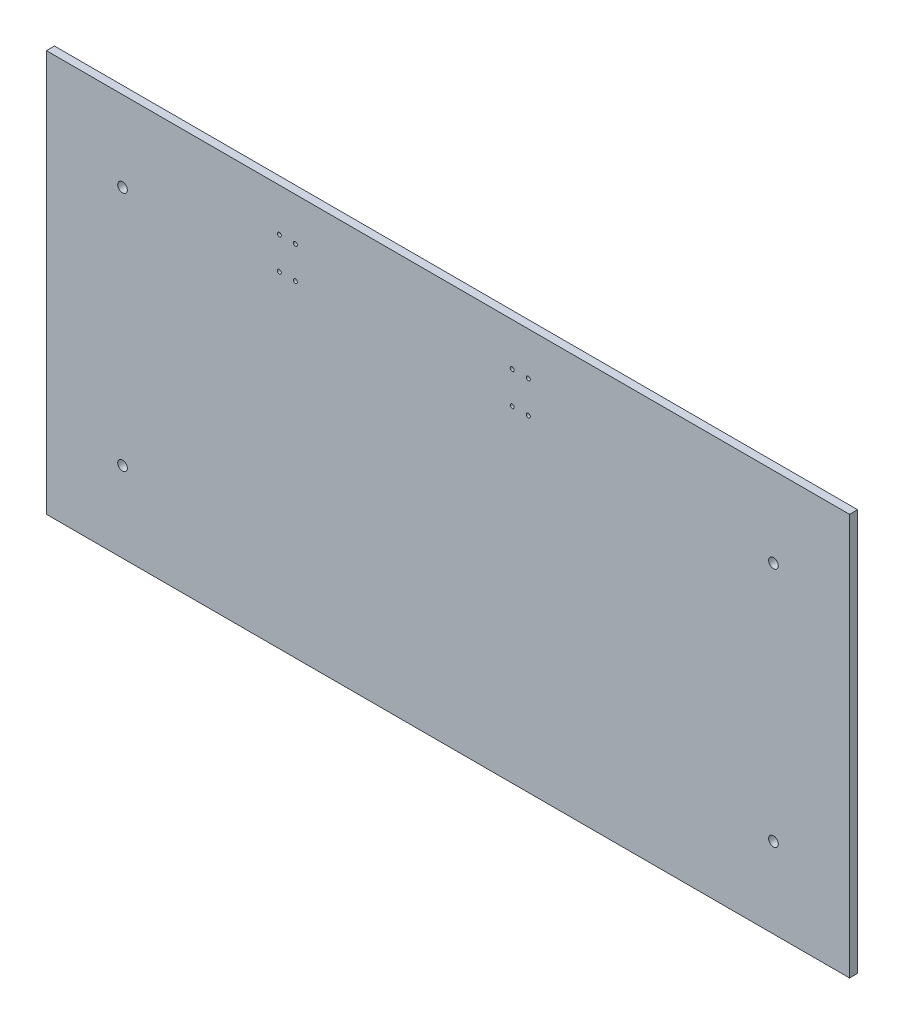
from build123d import *

# Parameters (mm, degrees)
SKETCH1_W           = 1000
SKETCH1_H           = 500
BOSS_EXTRUDE1_DEPTH = 10
SKETCH2_R           = 6
SKETCH2_R_2         = 2.5
CUT_EXTRUDE1_DEPTH  = 1393.332731882
SKETCH3_W           = 10
SKETCH3_H           = 200
BOSS_EXTRUDE2_DEPTH = 300
SKETCH4_R           = 5
CUT_EXTRUDE2_DEPTH  = 10
SKETCH7_W           = 307.440704133
SKETCH7_H           = 42.579188861
CUT_EXTRUDE5_DEPTH  = 1300


with BuildPart() as part:
    # Sketch1 → Boss-Extrude1 (new body)
    with BuildSketch(Plane.XY):
        with Locations((-555.321527736, 658.177796121)):
            Rectangle(SKETCH1_W, SKETCH1_H)
    extrude(amount=BOSS_EXTRUDE1_DEPTH)

    # Sketch2 → Cut-Extrude1 (cut, through all)
    with BuildSketch(Plane.XY.offset(10)):
        with Locations((-960.571527736, 808.177796121)):
            Circle(SKETCH2_R)
        with Locations((-960.571527736, 508.177796121)):
            Circle(SKETCH2_R)
        with Locations((-150.071527736, 508.177796121)):
            Circle(SKETCH2_R)
        with Locations((-150.071527736, 808.177796121)):
            Circle(SKETCH2_R)
        with Locations((-765.321527736, 854.697796121)):
            Circle(SKETCH2_R_2)
        with Locations((-745.321527736, 854.697796121)):
            Circle(SKETCH2_R_2)
        with Locations((-765.321527736, 814.697796121)):
            Circle(SKETCH2_R_2)
        with Locations((-745.321527736, 814.697796121)):
            Circle(SKETCH2_R_2)
        with Locations((-475.321527736, 814.697796121)):
            Circle(SKETCH2_R_2)
        with Locations((-455.321527736, 814.697796121)):
            Circle(SKETCH2_R_2)
        with Locations((-475.321527736, 854.697796121)):
            Circle(SKETCH2_R_2)
        with Locations((-455.321527736, 854.697796121)):
            Circle(SKETCH2_R_2)
    extrude(amount=-CUT_EXTRUDE1_DEPTH, mode=Mode.SUBTRACT)

    # Sketch3 → Boss-Extrude2 (add)
    with BuildSketch(Plane(origin=(-55.321527736, 0, 0), x_dir=(0, 0, -1), z_dir=(1, 0, 0))):
        with Locations((-5, 708.177796121)):
            Rectangle(SKETCH3_W, SKETCH3_H)
    extrude(amount=BOSS_EXTRUDE2_DEPTH)

    # Sketch4 → Cut-Extrude2 (cut)
    with BuildSketch(Plane.XY.offset(10)):
        with Locations((184.678472264, 708.177796121)):
            Circle(SKETCH4_R)
        with Locations((159.678472264, 708.177796121)):
            Circle(SKETCH4_R)
    extrude(amount=-CUT_EXTRUDE2_DEPTH, mode=Mode.SUBTRACT)

    # Sketch7 → Cut-Extrude5 (cut)
    with BuildSketch(Plane.XZ.offset(-608.177796121)):
        with Locations((98.398824331, -11.28959443)):
            Rectangle(SKETCH7_W, SKETCH7_H)
    extrude(amount=-CUT_EXTRUDE5_DEPTH, mode=Mode.SUBTRACT)


solid = part.part
